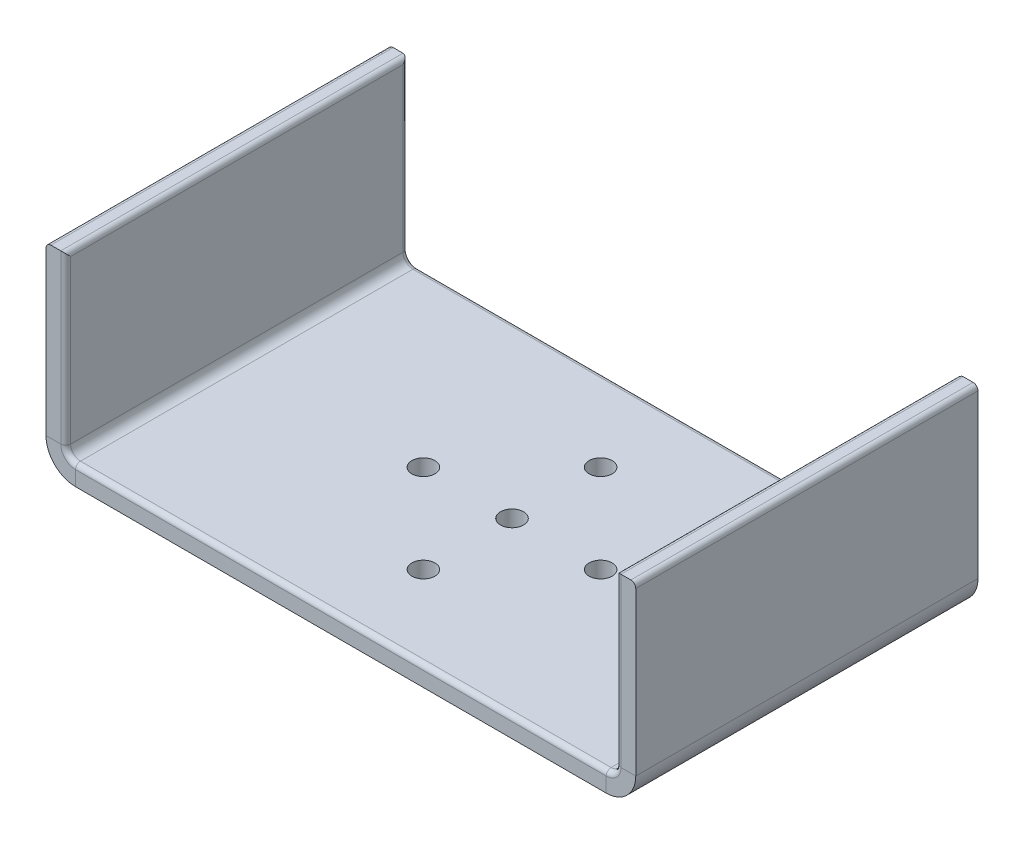
from build123d import *

# Parameters (mm, degrees)
SKETCH1_W                      = 59.9
SKETCH1_H                      = 34.76
BASE_FLANGE1_DEPTH             = 2
EDGE_FLANGE1_STRIP_W           = 10
EDGE_FLANGE1_STRIP_H           = 2
EDGE_FLANGE1_STRIP_CUT_DEPTH   = 34.76
EDGE_FLANGE1_STRIP_2_W         = 10
EDGE_FLANGE1_STRIP_2_H         = 2
EDGE_FLANGE1_STRIP_CUT_2_DEPTH = 34.76
EDGE_FLANGE1_DEPTH             = 34.76
EDGE_FLANGE1_BEND_DEPTH        = 34.76
FILLET1_R                      = 0.5
SKETCH8_R                      = 1.17
CUT_EXTRUDE1_DEPTH             = 10


# Sheet-metal steps are written as plain solids
with BuildPart() as part:
    # Sketch1 → Base-Flange1 (new body)
    with BuildSketch(Plane(origin=(0, 0, 0), x_dir=(1, 0, 0), z_dir=(0, 1, 0))):
        Rectangle(SKETCH1_W, SKETCH1_H)
    extrude(amount=-BASE_FLANGE1_DEPTH)

    # Edge-Flange1 strip (across the edge) → Edge-Flange1 strip cut (cut)
    with BuildSketch(Plane(origin=(-29.95, 0, -17.38), x_dir=(1, 0, 0), z_dir=(0, 0, 1))):
        with Locations((-2, -1)):
            Rectangle(EDGE_FLANGE1_STRIP_W, EDGE_FLANGE1_STRIP_H)
    extrude(amount=EDGE_FLANGE1_STRIP_CUT_DEPTH, mode=Mode.SUBTRACT)

    # Edge-Flange1 strip 2 (across the edge) → Edge-Flange1 strip cut 2 (cut)
    with BuildSketch(Plane(origin=(29.95, 0, 17.38), x_dir=(-1, 0, 0), z_dir=(0, 0, -1))):
        with Locations((-2, -1)):
            Rectangle(EDGE_FLANGE1_STRIP_2_W, EDGE_FLANGE1_STRIP_2_H)
    extrude(amount=EDGE_FLANGE1_STRIP_CUT_2_DEPTH, mode=Mode.SUBTRACT)

    # Edge-Flange1 section (across the edge) → Edge-Flange1 (add)
    with BuildSketch(Plane(origin=(-29.95, 0, -17.38), x_dir=(1, 0, 0), z_dir=(0, 0, 1))):
        with BuildLine():
            Line((0, 1), (0, 18))
            Line((0, 18), (2, 18))
            Line((2, 18), (2, 1))
            ThreePointArc((2, 1), (2.292893219, 0.292893219), (3, 0))
            Line((3, 0), (3, -2))
            ThreePointArc((3, -2), (0.878679656, -1.121320344), (0, 1))
        make_face()
    extrude(amount=EDGE_FLANGE1_DEPTH)

    # Edge-Flange1 section 2 (across the edge) → Edge-Flange1 bend (add)
    with BuildSketch(Plane(origin=(29.95, 0, 17.38), x_dir=(-1, 0, 0), z_dir=(0, 0, -1))):
        with BuildLine():
            Line((0, 1), (0, 18))
            Line((0, 18), (2, 18))
            Line((2, 18), (2, 1))
            ThreePointArc((2, 1), (2.292893219, 0.292893219), (3, 0))
            Line((3, 0), (3, -2))
            ThreePointArc((3, -2), (0.878679656, -1.121320344), (0, 1))
        make_face()
    extrude(amount=EDGE_FLANGE1_BEND_DEPTH)

    # Fillet1
    fillet1_edges = [part.edges().sort_by_distance(p)[0] for p in [
        (0, 0, 17.38),
        (0, 0, -17.38),
        (-27.657106781, 0.292893219, -17.38),
        (-27.657106781, 0.292893219, 17.38),
        (-27.95, 9.5, 17.38),
        (-27.95, 9.5, -17.38),
        (-29.95, 18, 0),
        (-27.95, 18, 0),
        (27.657106781, 0.292893219, 17.38),
        (27.657106781, 0.292893219, -17.38),
        (27.95, 9.5, 17.38),
        (27.95, 9.5, -17.38),
        (29.95, 18, 0),
        (27.95, 18, 0),
    ]]
    fillet(fillet1_edges, radius=FILLET1_R)

    # Sketch8 → Cut-Extrude1 (cut)
    with BuildSketch(Plane(origin=(0, 0, 0), x_dir=(1, 0, 0), z_dir=(0, 1, 0))):
        with Locations(Location((0, 0, 0), (0, 0, 270))):
            Circle(SKETCH8_R)
        with Locations(Location((0, 9, 0), (0, 0, 270))):
            Circle(SKETCH8_R)
        with Locations(Location((9, 0, 0), (0, 0, 270))):
            Circle(SKETCH8_R)
        with Locations(Location((0, -9, 0), (0, 0, 270))):
            Circle(SKETCH8_R)
        with Locations(Location((-9, 0, 0), (0, 0, 270))):
            Circle(SKETCH8_R)
    extrude(amount=-CUT_EXTRUDE1_DEPTH, mode=Mode.SUBTRACT)


solid = part.part
